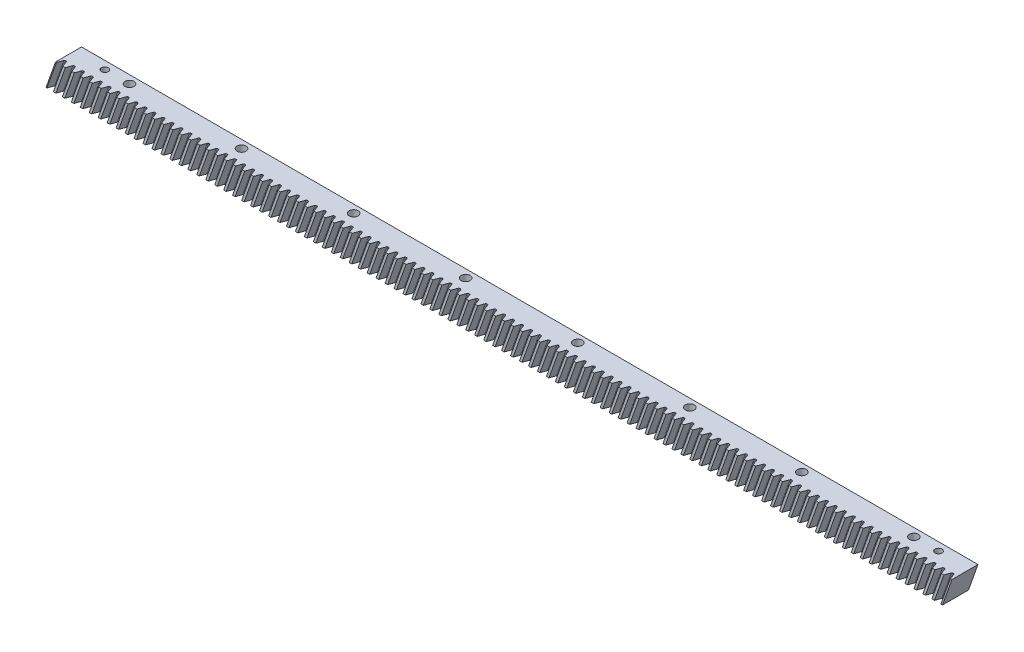
from build123d import *

# Parameters (mm, degrees)
EXTRUDE_2_DEPTH        = 29
CUT_EXTRUDE_1_REACH    = 1013.485
SKETCH_2_R             = 3.85
PATTERN_LINEAR_1_COUNT = 2
PATTERN_LINEAR_1_PITCH = 930
SKETCH_3_R             = 5
CUT_EXTRUDE_2_DEPTH    = 21
SKETCH_4_R             = 7.5
CUT_EXTRUDE_3_DEPTH    = 9
PATTERN_LINEAR_2_COUNT = 8
PATTERN_LINEAR_2_PITCH = 125
CUT_EXTRUDE_4_DEPTH    = 31.825460988
PATTERN_LINEAR_3_COUNT = 100
PATTERN_LINEAR_3_PITCH = 10


with BuildPart() as part:
    # 草图1 → 凸台-拉伸2 (new body)
    with BuildSketch(Plane.XY):
        Polygon((0, 0), (10.623557176, 30), (1000, 30), (1010.623557176, 30), (1000, 0), align=None)
    extrude(amount=EXTRUDE_2_DEPTH)

    # 草图2 → 切除-拉伸1 (cut, up to next)
    with BuildSketch(Plane(origin=(0, 30, 0), x_dir=(1, 0, 0), z_dir=(0, 1, 0)), mode=Mode.PRIVATE) as cut_extrude_1_sk1:
        with Locations(Location((45.623557176, -9, 0), (0, 0, 270))):
            Circle(SKETCH_2_R)
    cut_extrude_1_tool1 = extrude(cut_extrude_1_sk1.sketch, amount=-CUT_EXTRUDE_1_REACH, mode=Mode.PRIVATE) & part.part
    cut_extrude_1 = cut_extrude_1_tool1.solids().sort_by_distance((45.623557, 30, 9))[0]
    add(cut_extrude_1, mode=Mode.SUBTRACT)

    # 阵列(线性)1: 切除-拉伸1 ×2
    with Locations(*[(i * PATTERN_LINEAR_1_PITCH, 0, 0) for i in range(1, PATTERN_LINEAR_1_COUNT)]):
        add(cut_extrude_1, mode=Mode.SUBTRACT)

    # 草图3 → 切除-拉伸2 (cut)
    with BuildSketch(Plane(origin=(0, 30, 0), x_dir=(1, 0, 0), z_dir=(0, 1, 0))):
        with Locations(Location((73.123557176, -9, 0), (0, 0, 270))):
            Circle(SKETCH_3_R)
    cut_extrude_2 = extrude(amount=-CUT_EXTRUDE_2_DEPTH, mode=Mode.SUBTRACT)

    # 草图4 → 切除-拉伸3 (cut)
    with BuildSketch(Plane.XZ):
        with Locations(Location((73.123557176, 9, 0), (0, 0, 270))):
            Circle(SKETCH_4_R)
    cut_extrude_3 = extrude(amount=-CUT_EXTRUDE_3_DEPTH, mode=Mode.SUBTRACT)

    # 阵列(线性)2: 切除-拉伸2, 切除-拉伸3 ×8
    with Locations(*[(i * PATTERN_LINEAR_2_PITCH, 0, 0) for i in range(1, PATTERN_LINEAR_2_COUNT)]):
        add(cut_extrude_2, mode=Mode.SUBTRACT)
        add(cut_extrude_3, mode=Mode.SUBTRACT)

    # 草图6 → 切除-拉伸4 (cut, along a direction that is not the sketch's normal)
    with BuildSketch(Plane(origin=(0, 30, 0), x_dir=(1, 0, 0), z_dir=(0, 1, 0))):
        with BuildLine():
            Line((11.623557176, -29), (13.840871175, -22.907979857))
            ThreePointArc((13.840871175, -22.907979857), (14.206987359, -22.430847956), (14.780563795, -22.25))
            Line((14.780563795, -22.25), (15.650371962, -22.25))
            ThreePointArc((15.650371962, -22.25), (16.223948398, -22.430847956), (16.590064583, -22.907979857))
            Line((16.590064583, -22.907979857), (18.807378582, -29))
            Line((18.807378582, -29), (11.623557176, -29))
        make_face()
    cut_extrude_4 = extrude(amount=-CUT_EXTRUDE_4_DEPTH, dir=(0.33380685923376835, 0.9426414910921793, 0), mode=Mode.SUBTRACT)

    # 阵列(线性)3: 切除-拉伸4 ×100
    with Locations(*[(i * PATTERN_LINEAR_3_PITCH, 0, 0) for i in range(1, PATTERN_LINEAR_3_COUNT)]):
        add(cut_extrude_4, mode=Mode.SUBTRACT)


solid = part.part
